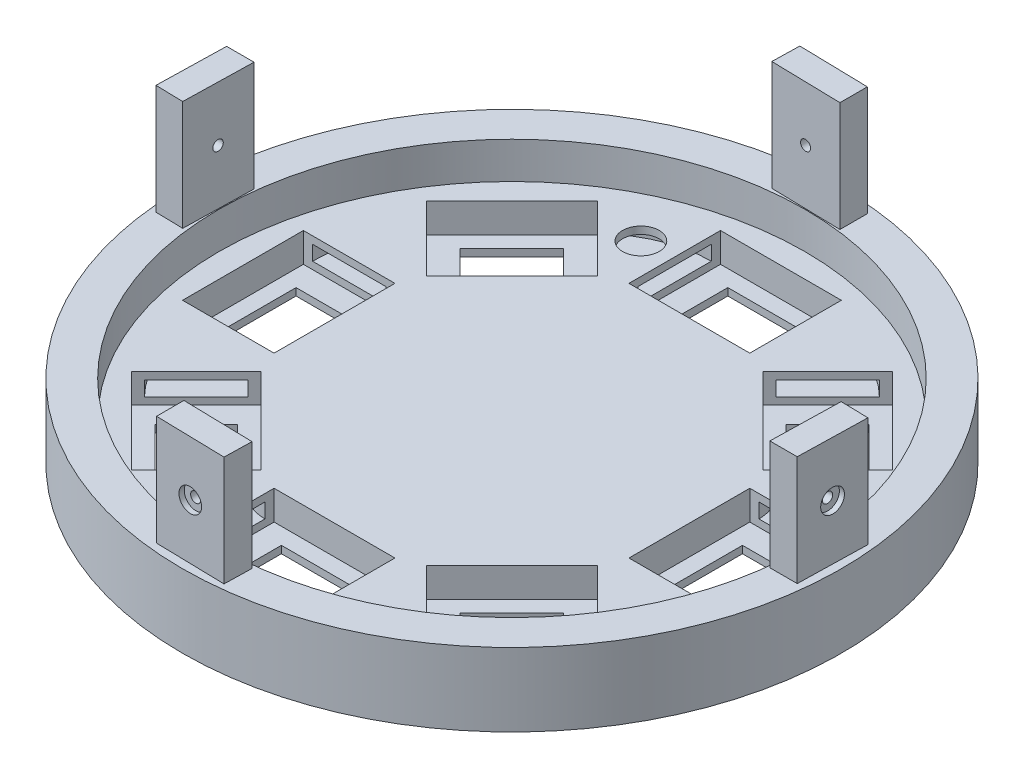
from build123d import *

# Parameters (mm, degrees)
SKETCH2_R                                     = 45
BOSS_EXTRUDE1_DEPTH                           = 10
SKETCH3_R                                     = 40
CUT_EXTRUDE1_DEPTH                            = 5
SKETCH4_W                                     = 16.5
SKETCH4_H                                     = 12.5
SKETCH4_W_2                                   = 12.5
SKETCH4_H_2                                   = 16.5
CUT_EXTRUDE2_DEPTH                            = 4
SKETCH6_W                                     = 10
SKETCH6_H                                     = 8
CUT_EXTRUDE3_DEPTH                            = 65.272855857
CIRPATTERN1_COUNT                             = 8
SKETCH7_W                                     = 10
SKETCH7_H                                     = 2.006854622
CUT_REVOLVE1_ANGLE                            = 45
CIRPATTERN8_COUNT                             = 8
CUT_EXTRUDE4_REACH                            = 65.836
SKETCH10_R                                    = 2.5
BOSS_EXTRUDE2_DEPTH                           = 15
CIRPATTERN9_COUNT                             = 4
CBORE_START                                   = 40.100162841
CBORE_FOR_00_BINDING_HEAD_MACHINE_S_2_R       = 0.6985
CBORE_FOR_00_BINDING_HEAD_MACHINE_SCREW_DEPTH = 3.739789051
CBORE_START_2                                 = 43.128751892
CBORE_FOR_00_BINDING_HEAD_MACHINE_S_3_O_R     = 1.5875
CBORE_FOR_00_BINDING_HEAD_MACHINE_S_3_O_R_2   = 0.6985
CBORE_FOR_00_BINDING_HEAD_MACHINE_S_3_DEPTH   = 0.7112
CIRPATTERN10_COUNT                            = 4


# Read off the part's stored shape, not the designer's step: CBORE for #00 Binding Head Machine Screw3
with BuildPart() as part:
    # Sketch2 → Boss-Extrude1 (new body)
    with BuildSketch(Plane(origin=(0, 0, 0), x_dir=(1, 0, 0), z_dir=(0, 1, 0))):
        with Locations(Location((0, 0, 0), (0, 0, 270))):
            Circle(SKETCH2_R)
    extrude(amount=BOSS_EXTRUDE1_DEPTH)

    # Sketch3 → Cut-Extrude1 (cut)
    with BuildSketch(Plane(origin=(0, 10, 0), x_dir=(1, 0, 0), z_dir=(0, 1, 0))):
        with Locations(Location((0, 0, 0), (0, 0, 270))):
            Circle(SKETCH3_R)
    extrude(amount=-CUT_EXTRUDE1_DEPTH, mode=Mode.SUBTRACT)

    # Sketch4 → Cut-Extrude2 (cut)
    with BuildSketch(Plane(origin=(0, 5, 0), x_dir=(1, 0, 0), z_dir=(0, 1, 0))):
        with Locations((0, 30.477478673)):
            Rectangle(SKETCH4_W, SKETCH4_H)
        Polygon((20.136618281, 31.80388017), (11.297783516, 22.965045405), (22.965045405, 11.297783516), (31.80388017, 20.136618281), align=None)
        with Locations((30.477478673, 0)):
            Rectangle(SKETCH4_W_2, SKETCH4_H_2)
        Polygon((31.80388017, -20.136618281), (22.965045405, -11.297783516), (11.297783516, -22.965045405), (20.136618281, -31.80388017), align=None)
        with Locations((0, -30.477478673)):
            Rectangle(SKETCH4_W, SKETCH4_H)
        Polygon((-20.136618281, -31.80388017), (-11.297783516, -22.965045405), (-22.965045405, -11.297783516), (-31.80388017, -20.136618281), align=None)
        with Locations((-30.477478673, 0)):
            Rectangle(SKETCH4_W_2, SKETCH4_H_2)
        Polygon((-31.80388017, 20.136618281), (-22.965045405, 11.297783516), (-11.297783516, 22.965045405), (-20.136618281, 31.80388017), align=None)
    extrude(amount=-CUT_EXTRUDE2_DEPTH, mode=Mode.SUBTRACT)

    # Sketch6 → Cut-Extrude3 (cut, through all)
    with BuildSketch(Plane(origin=(0, 1, 0), x_dir=(1, 0, 0), z_dir=(0, 1, 0))):
        with Locations((0, 30.477478673)):
            Rectangle(SKETCH6_W, SKETCH6_H)
    cut_extrude3 = extrude(amount=-CUT_EXTRUDE3_DEPTH, mode=Mode.SUBTRACT)

    # CirPattern1: Cut-Extrude3 ×8 about axis
    cirpattern1_axis = Axis((0, 0, 0), (0, 1, 0))
    for i in range(1, CIRPATTERN1_COUNT):
        add(cut_extrude3.rotate(cirpattern1_axis, i * 360 / CIRPATTERN1_COUNT), mode=Mode.SUBTRACT)

    # Sketch7 → Cut-Revolve1 (revolve, cut)
    with BuildSketch(Plane(origin=(-8.25, 0, 0), x_dir=(0, 0, -1), z_dir=(1, 0, 0))):
        with Locations((30.477478673, 3)):
            Rectangle(SKETCH7_W, SKETCH7_H)
    cut_revolve1 = revolve(axis=Axis((-8.25, 5, -19.91726189), (0, 1, 0)), revolution_arc=CUT_REVOLVE1_ANGLE, mode=Mode.SUBTRACT)

    # CirPattern8: Cut-Revolve1 ×8 about axis
    cirpattern8_axis = Axis((0, 0, 0), (0, 1, 0))
    for i in range(1, CIRPATTERN8_COUNT):
        add(cut_revolve1.rotate(cirpattern8_axis, i * 360 / CIRPATTERN8_COUNT), mode=Mode.SUBTRACT)

    # Sketch10 → Cut-Extrude4 (cut, up to next)
    with BuildSketch(Plane(origin=(0, 5, 0), x_dir=(1, 0, 0), z_dir=(0, 1, 0)), mode=Mode.PRIVATE) as cut_extrude4_sk1:
        with Locations(Location((-12.45, 30.056958852, 0), (0, 0, 270))):
            Circle(SKETCH10_R)
    cut_extrude4_tool1 = extrude(cut_extrude4_sk1.sketch, amount=-CUT_EXTRUDE4_REACH, mode=Mode.PRIVATE) & part.part
    add(cut_extrude4_tool1.solids().sort_by_distance((-12.45, 5, -30.056959))[0], mode=Mode.SUBTRACT)

    # Sketch11 → Boss-Extrude2 (add)
    with BuildSketch(Plane(origin=(0, 10, 0), x_dir=(1, 0, 0), z_dir=(0, 1, 0))):
        Polygon((40.22065381, 4.733059783), (39.999995725, -4.78576812), (43.740789465, -4.78576812), (43.959438442, 4.646390178), align=None)
    boss_extrude2 = extrude(amount=BOSS_EXTRUDE2_DEPTH)

    # CirPattern9: Boss-Extrude2 ×4 about axis
    cirpattern9_axis = Axis((0, 0, 0), (0, 1, 0))
    for i in range(1, CIRPATTERN9_COUNT):
        add(boss_extrude2.rotate(cirpattern9_axis, i * 360 / CIRPATTERN9_COUNT))

    # CBORE for _00 Binding Head Machine S 2 → CBORE for #00 Binding Head Machine Screw3 (cut)
    with BuildSketch(Plane(origin=(0, 0, 0), x_dir=(0, 1, 0), z_dir=(0.9997314236585955, 0, 0.02317499837233911)).offset(CBORE_START)):
        with Locations((17.5, -0.946556065)):
            Circle(CBORE_FOR_00_BINDING_HEAD_MACHINE_S_2_R)
    cbore_for_00_binding_head_machine_screw = extrude(amount=CBORE_FOR_00_BINDING_HEAD_MACHINE_SCREW_DEPTH, mode=Mode.SUBTRACT)

    # CBORE for _00 Binding Head Machine S 3 o → CBORE for _00 Binding Head Machine S 3 (cut)
    with BuildSketch(Plane(origin=(0, 0, 0), x_dir=(0, 1, 0), z_dir=(0.9997314236585955, 0, 0.02317499837233911)).offset(CBORE_START_2)):
        with Locations((17.5, -0.946556065)):
            Circle(CBORE_FOR_00_BINDING_HEAD_MACHINE_S_3_O_R)
        with Locations((17.5, -0.946556065)):
            Circle(CBORE_FOR_00_BINDING_HEAD_MACHINE_S_3_O_R_2, mode=Mode.SUBTRACT)
    cbore_for_00_binding_head_machine_s_3 = extrude(amount=CBORE_FOR_00_BINDING_HEAD_MACHINE_S_3_DEPTH, mode=Mode.SUBTRACT)

    # CirPattern10: CBORE for #00 Binding Head Machine Screw3, CBORE for _00 Binding Head Machine S 3 ×4 about axis
    cirpattern10_axis = Axis((0, 0, 0), (0, 1, 0))
    add([cbore_for_00_binding_head_machine_screw.rotate(cirpattern10_axis, i * 360 / CIRPATTERN10_COUNT) for i in range(1, CIRPATTERN10_COUNT)], mode=Mode.SUBTRACT)
    add([cbore_for_00_binding_head_machine_s_3.rotate(cirpattern10_axis, i * 360 / CIRPATTERN10_COUNT) for i in range(1, CIRPATTERN10_COUNT)], mode=Mode.SUBTRACT)


solid = part.part
